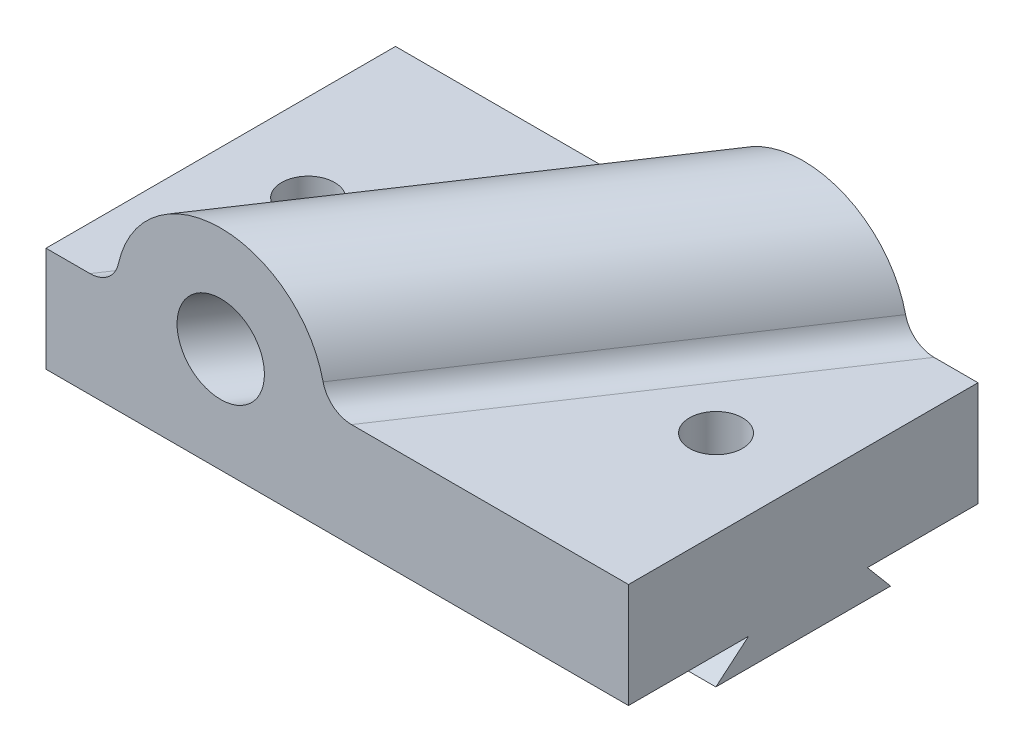
from build123d import *

# Parameters (mm, degrees)
BOSS_EXTRUDE1_DEPTH     = 100
SKETCH6_R               = 7.5
CUT_EXTRUDE1_DEPTH      = 123.049170419
CUT_EXTRUDE1_DEPTH_BACK = 123.049170419
SKETCH7_R               = 4.551669689


with BuildPart() as part:
    # Sketch1 → Boss-Extrude1 (new body)
    with BuildSketch(Plane(origin=(0, 0, 0), x_dir=(0, 0, -1), z_dir=(1, 0, 0))):
        Polygon((45, -4.73), (41.010615422, 0), (60, 0), (60, 18), (0, 18), (0, 0), (20.608108108, 0), (15, -4.73), align=None)
    extrude(amount=BOSS_EXTRUDE1_DEPTH)

    # Sweep5: sweep along a path in Sketch3
    with BuildLine(Plane(origin=(0, 0, 0), x_dir=(1, 0, 0), z_dir=(0, 1, 0))) as sweep5_path:
        Line((30, 0), (70, 60))
    # Sketch2 → Sweep5 (sweep)
    with BuildSketch(Plane.XY):
        with BuildLine():
            Line((7.550055679, 18), (52.449944321, 18))
            ThreePointArc((52.449944321, 18), (49.32222811, 19.099052512), (47.569521642, 21.913043478))
            ThreePointArc((47.569521642, 21.913043478), (30, 36), (12.430478358, 21.913043478))
            ThreePointArc((12.430478358, 21.913043478), (10.67777189, 19.099052512), (7.550055679, 18))
        make_face()
    sweep(path=sweep5_path.line)

    # Cut-Sweep3: sweep along a path in Sketch3<4>
    with BuildLine(Plane(origin=(0, 0, 0), x_dir=(1, 0, 0), z_dir=(0, 1, 0))) as cut_sweep3_path:
        Line((30, 0), (70, 60))
    # Sketch6 → Cut-Sweep3 (sweep, cut)
    with BuildSketch(Plane(origin=(0, 0, -60), x_dir=(-1, 0, 0), z_dir=(0, 0, -1))):
        with Locations((-69.99646769, 18)):
            Circle(SKETCH6_R)
    sweep(path=cut_sweep3_path.line, mode=Mode.SUBTRACT)

    # Sketch7 → Cut-Extrude1 (cut, two sides: drawn at the far end of the back side and taken through both)
    with BuildSketch(Plane(origin=(0, 0, 0), x_dir=(1, 0, 0), z_dir=(0, 1, 0)).offset(-CUT_EXTRUDE1_DEPTH_BACK)):
        with Locations((15, 30)):
            Circle(SKETCH7_R)
        with Locations((84.999992632, 30.022710288)):
            Circle(SKETCH7_R)
    extrude(amount=CUT_EXTRUDE1_DEPTH + CUT_EXTRUDE1_DEPTH_BACK, mode=Mode.SUBTRACT)


solid = part.part
